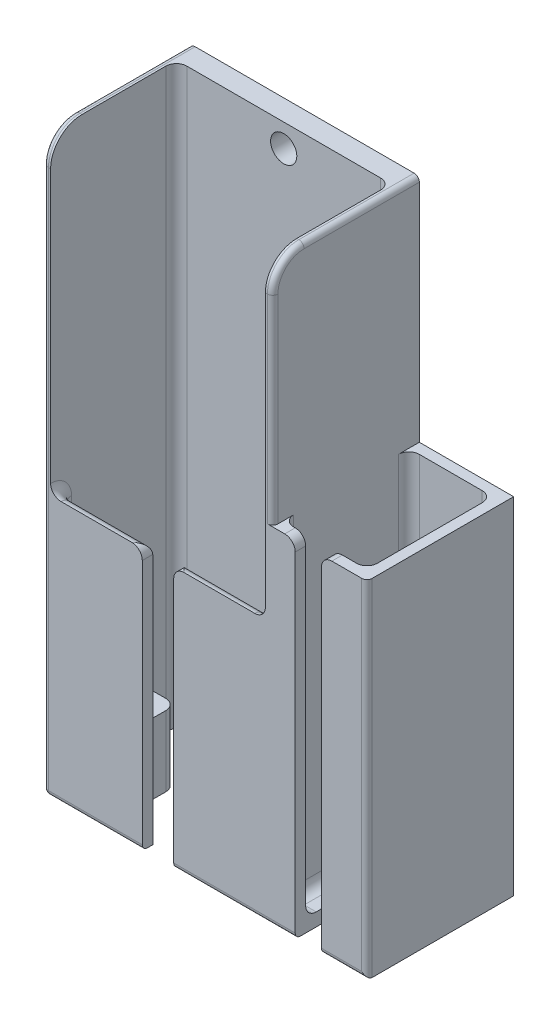
from build123d import *

# Parameters (mm, degrees)
SKETCH1_W           = 55.626
SKETCH1_H           = 139.7
BOSS_EXTRUDE1_DEPTH = 35.56
CUT_EXTRUDE1_DEPTH  = 27.94
CUT_EXTRUDE6_DEPTH  = 30.48
SKETCH4_R           = 3.175
CUT_EXTRUDE7_DEPTH  = 155.514903734
SKETCH5_W           = 12.7
SKETCH5_H           = 12.7
CUT_EXTRUDE8_DEPTH  = 140.273747309
BOSS_EXTRUDE2_DEPTH = 83.82
SKETCH7_W           = 20.32
SKETCH7_H           = 30.48
SKETCH7_R           = 6.35
BOSS_EXTRUDE3_DEPTH = 3.175
SKETCH8_W           = 6.35
SKETCH8_H           = 83.82
CUT_EXTRUDE9_DEPTH  = 17.78
FILLET1_R           = 7.62
FILLET2_R           = 2.54
FILLET3_R           = 1.27


with BuildPart() as part:
    # Sketch1 → Boss-Extrude1 (new body)
    with BuildSketch(Plane.XY):
        with Locations((27.813, -69.85)):
            Rectangle(SKETCH1_W, SKETCH1_H)
    extrude(amount=BOSS_EXTRUDE1_DEPTH)

    # Sketch2 → Cut-Extrude1 (cut)
    with BuildSketch(Plane(origin=(0, 0, 5.08), x_dir=(-1, 0, 0), z_dir=(0, 0, -1))):
        Polygon((-1.778, -33.02), (-53.848, -33.02), (-53.848, -122.6312), (-41.148, -122.6312), (-41.148, -139.7), (-14.478, -139.7), (-14.478, -122.6312), (-1.778, -122.6312), align=None)
    extrude(amount=-CUT_EXTRUDE1_DEPTH, mode=Mode.SUBTRACT)

    # Sketch3 → Cut-Extrude6 (cut)
    with BuildSketch(Plane.XY.offset(35.56)):
        Polygon((24.003, -139.7), (31.623, -139.7), (31.623, -76.2), (53.848, -76.2), (53.848, 0), (1.778, 0), (1.778, -76.2), (24.003, -76.2), align=None)
    extrude(amount=-CUT_EXTRUDE6_DEPTH, mode=Mode.SUBTRACT)

    # Sketch4 → Cut-Extrude7 (cut, through all)
    with BuildSketch(Plane(origin=(0, 0, 0), x_dir=(-1, 0, 0), z_dir=(0, 0, -1))):
        with Locations((-27.813, -5.588)):
            Circle(SKETCH4_R)
    extrude(amount=-CUT_EXTRUDE7_DEPTH, mode=Mode.SUBTRACT)

    # Sketch5 → Cut-Extrude8 (cut, through all)
    with BuildSketch(Plane(origin=(0, -122.6312, 0), x_dir=(1, 0, 0), z_dir=(0, 1, 0))):
        with Locations((8.128, -11.43)):
            Rectangle(SKETCH5_W, SKETCH5_H)
        with Locations((47.498, -26.67)):
            Rectangle(SKETCH5_W, SKETCH5_H)
    extrude(amount=-CUT_EXTRUDE8_DEPTH, mode=Mode.SUBTRACT)

    # Sketch6 → Boss-Extrude2 (add)
    with BuildSketch(Plane.XZ.offset(139.7)):
        Polygon((55.626, 0), (78.486, 0), (78.486, 35.56), (55.626, 35.56), (55.626, 33.02), (75.946, 33.02), (75.946, 2.54), (55.626, 2.54), align=None)
    extrude(amount=-BOSS_EXTRUDE2_DEPTH)

    # Sketch7 → Boss-Extrude3 (add)
    with BuildSketch(Plane.XZ.offset(139.7)):
        with Locations((65.786, 17.78)):
            Rectangle(SKETCH7_W, SKETCH7_H)
        with Locations(Location((64.262, 17.78, 0), (0, 0, 270))):
            Circle(SKETCH7_R, mode=Mode.SUBTRACT)
    extrude(amount=-BOSS_EXTRUDE3_DEPTH)

    # Sketch8 → Cut-Extrude9 (cut)
    with BuildSketch(Plane.XY.offset(35.56)):
        with Locations((64.262, -97.79)):
            Rectangle(SKETCH8_W, SKETCH8_H)
    extrude(amount=-CUT_EXTRUDE9_DEPTH, mode=Mode.SUBTRACT)

    # Fillet1
    fillet1_edges = [part.edges().sort_by_distance(p)[0] for p in [
        (67.437, -138.1125, 23.279261314),
        (61.087, -138.1125, 23.279261314),
        (54.737, 0, 35.56),
        (14.478, -131.1656, 33.02),
        (41.148, -131.1656, 5.08),
        (0.889, 0, 35.56),
    ]]
    fillet(fillet1_edges, radius=FILLET1_R)

    # Fillet2
    fillet2_edges = [part.edges().sort_by_distance(p)[0] for p in [
        (53.848, -131.1656, 20.32),
        (41.148, -131.1656, 20.32),
        (55.626, -96.2025, 2.54),
        (75.946, -96.2025, 2.54),
        (75.946, -96.2025, 33.02),
        (55.626, -96.2025, 33.02),
        (55.626, -136.525, 17.78),
        (71.6915, -136.525, 33.02),
        (75.946, -136.525, 17.78),
        (65.786, -136.525, 2.54),
        (58.3565, -136.525, 33.02),
        (61.087, -55.88, 34.29),
        (67.437, -55.88, 34.29),
        (1.778, -99.4156, 33.02),
        (11.938, -122.6312, 33.02),
        (1.778, -122.6312, 25.4),
        (43.688, -122.6312, 5.08),
        (1.778, -69.85, 5.08),
        (53.848, -61.3156, 5.08),
        (53.848, -107.95, 33.02),
        (12.8905, -76.2, 33.02),
        (1.778, -76.2, 34.29),
        (42.7355, -76.2, 33.02),
        (24.003, -76.2, 34.29),
        (53.848, -76.2, 34.29),
        (31.623, -76.2, 34.29),
        (53.848, -122.6312, 12.7),
        (1.778, -131.1656, 17.78),
        (14.478, -131.1656, 17.78),
    ]]
    fillet(fillet2_edges, radius=FILLET2_R - 0.0001)  # a hair under: the kernel refuses the full size

    # Fillet3
    fillet3_edges = [part.edges().sort_by_distance(p)[0] for p in [
        (55.626, -31.75, 35.56),
        (78.486, -97.79, 35.56),
        (72.9615, -139.7, 35.56),
        (55.626, 0, 13.97),
        (0, 0, 13.97),
        (55.626, -2.231846327, 33.328153673),
        (0, -73.66, 35.56),
        (0, -2.231846327, 33.328153673),
        (46.355, -139.7, 35.56),
        (0, -139.7, 17.78),
        (12.0015, -139.7, 35.56),
    ]]
    fillet(fillet3_edges, radius=FILLET3_R)


solid = part.part
